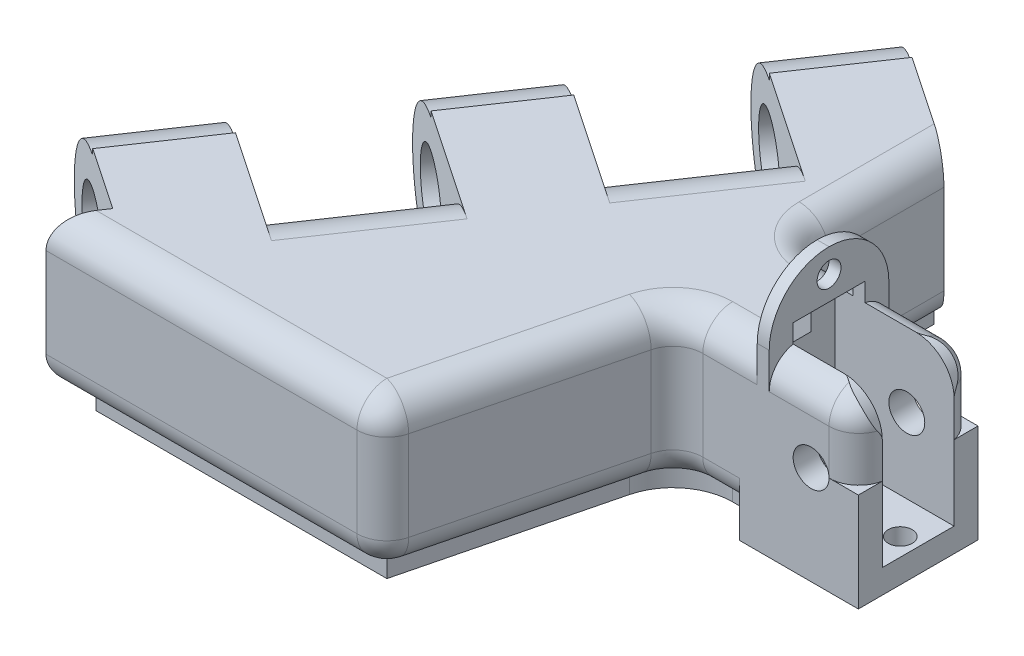
from build123d import *

# Parameters (mm, degrees)
SKETCH1_W            = 120
SKETCH1_H            = 120
SKETCH1_W_2          = 20
SKETCH1_H_2          = 20
SKETCH1_H_3          = 30
SKETCH1_W_3          = 30
BOSS_EXTRUDE1_DEPTH  = 25
CUT_EXTRUDE2_DEPTH   = 50
FILLET3_R            = 5
FILLET4_R            = 5
CUT_EXTRUDE4_DEPTH   = 130.711217711
SKETCH7_W            = 17.18
SKETCH7_H            = 25
BOSS_EXTRUDE2_DEPTH  = 25
FILLET5_R            = 10
CUT_EXTRUDE5_DEPTH   = 143.225012873
SKETCH9_R            = 6.665
CUT_EXTRUDE6_DEPTH   = 143.225012873
CUT_EXTRUDE7_DEPTH   = 143.225012873
SKETCH11_W           = 20
SKETCH11_H           = 25
CUT_EXTRUDE8_DEPTH   = 15
SKETCH12_W           = 40
SKETCH12_H           = 12
CUT_EXTRUDE9_DEPTH   = 112.018016556
SKETCH13_R           = 3
CUT_EXTRUDE10_DEPTH  = 112.914941802
BOSS_EXTRUDE3_REACH  = 113.915
SKETCH17_W           = 19.898979486
SKETCH17_H           = 12
CUT_EXTRUDE12_DEPTH  = 109.80292511
BOSS_EXTRUDE4_DEPTH  = 4
SKETCH19_W           = 4.898979486
SKETCH19_H           = 4
BOSS_EXTRUDE5_DEPTH  = 16.5
SKETCH20_W           = 15
SKETCH20_H           = 0.101020514
BOSS_EXTRUDE6_DEPTH  = 4
SKETCH21_W           = 15
SKETCH21_H           = 0.101020514
BOSS_EXTRUDE7_DEPTH  = 4
CUT_EXTRUDE13_DEPTH  = 112.914941802
SKETCH24_R           = 2
CUT_EXTRUDE14_DEPTH  = 112.905435687
SKETCH25_W           = 4
SKETCH25_H           = 4
BOSS_EXTRUDE8_DEPTH  = 2
CUT_EXTRUDE15_DEPTH  = 108.704680589
SKETCH27_W           = 4.472135955
SKETCH27_H           = 4
CUT_EXTRUDE16_DEPTH  = 104.54697643
SKETCH28_W           = 2
SKETCH28_H           = 4
BOSS_EXTRUDE9_DEPTH  = 40
SKETCH29_W           = 2
SKETCH29_H           = 8
BOSS_EXTRUDE10_DEPTH = 20
FILLET6_R            = 10
SKETCH30_R           = 2
CUT_EXTRUDE17_DEPTH  = 120.003275165
SCALE2_SCALE         = 0.75


# Some blends are built 0.0001 mm under size
with BuildPart() as part:
    # Sketch1 → Boss-Extrude1 (new body)
    with BuildSketch(Plane(origin=(0, 0, 0), x_dir=(1, 0, 0), z_dir=(0, 1, 0))):
        Rectangle(SKETCH1_W, SKETCH1_H)
        with Locations((50, 70)):
            Rectangle(SKETCH1_W_2, SKETCH1_H_2)
        with Locations((16.666666667, 75)):
            Rectangle(SKETCH1_W_2, SKETCH1_H_3)
        with Locations((-16.666666667, 75)):
            Rectangle(SKETCH1_W_2, SKETCH1_H_3)
        with Locations((-50, 70)):
            Rectangle(SKETCH1_W_2, SKETCH1_H_2)
        with Locations((75, -10)):
            Rectangle(SKETCH1_W_3, SKETCH1_H_2)
    extrude(amount=BOSS_EXTRUDE1_DEPTH)

    # Sketch3 → Cut-Extrude2 (cut)
    with BuildSketch(Plane(origin=(0, 25, 0), x_dir=(1, 0, 0), z_dir=(0, 1, 0))):
        Polygon((-60, 5), (-30, -60), (-60, -60), align=None)
        Polygon((50, -60), (60, -20), (60, -60), align=None)
    extrude(amount=-CUT_EXTRUDE2_DEPTH, mode=Mode.SUBTRACT)

    # Fillet3
    fillet3_edges = [part.edges().sort_by_distance(p)[0] for p in [
        (75, 25, 20),
        (75, 25, 0),
        (-40, 0, -70),
        (-33.333333333, 0, -60),
        (-26.666666667, 0, -75),
        (-6.666666667, 0, -75),
        (0, 0, -60),
        (60, 25, -40),
        (6.666666667, 0, -75),
        (26.666666667, 0, -75),
        (33.333333333, 0, -60),
        (40, 0, -70),
        (60, 0, -40),
        (75, 0, 0),
        (75, 0, 20),
        (40, 25, -70),
        (-60, 12.5, -80),
        (-40, 12.5, -80),
        (-40, 12.5, -60),
        (-26.666666667, 12.5, -60),
        (-26.666666667, 12.5, -90),
        (-6.666666667, 12.5, -90),
        (-6.666666667, 12.5, -60),
        (6.666666667, 12.5, -60),
        (6.666666667, 12.5, -90),
        (26.666666667, 12.5, -90),
        (26.666666667, 12.5, -60),
        (40, 12.5, -60),
        (40, 12.5, -80),
        (33.333333333, 25, -60),
        (60, 12.5, -80),
        (60, 12.5, 0),
        (60, 12.5, 20),
        (26.666666667, 25, -75),
        (6.666666667, 25, -75),
        (0, 25, -60),
        (-6.666666667, 25, -75),
        (10, 0, 60),
        (-60, 0, -42.5),
        (55, 0, 40),
        (-45, 0, 27.5),
        (-26.666666667, 25, -75),
        (10, 25, 60),
        (-60, 25, -42.5),
        (-33.333333333, 25, -60),
        (-60, 12.5, -5),
        (-30, 12.5, 60),
        (-45, 25, 27.5),
        (-40, 25, -70),
        (50, 12.5, 60),
        (55, 25, 40),
    ]]
    fillet(fillet3_edges, radius=FILLET3_R)

    # Fillet4
    # the kernel refuses this fillet: 5 mm, written as the material it takes off along each edge
    with BuildSketch(Plane(origin=(-45, 5, -75), x_dir=(0, 0, -1), z_dir=(0, -1, 0))) as fillet4_piece_1_section:
        Polygon((0, 0), (FILLET4_R, 0), (FILLET4_R, FILLET4_R), (0, FILLET4_R), align=None)
    fillet4_piece_1 = extrude(amount=FILLET4_R, mode=Mode.PRIVATE)
    fillet4_piece_1 = fillet4_piece_1 - Plane(origin=(-45, 5, -75), x_dir=(-0.7071067811865474, 0, 0.7071067811865477), z_dir=(0, -1, 0)) * Sphere(FILLET4_R, mode=Mode.PRIVATE)
    add(fillet4_piece_1, mode=Mode.SUBTRACT)
    with BuildSketch(Plane(origin=(-21.666666667, 5, -85), x_dir=(0, 0, -1), z_dir=(0, -1, 0))) as fillet4_piece_2_section:
        Polygon((0, 0), (FILLET4_R, 0), (FILLET4_R, -FILLET4_R), (0, -FILLET4_R), align=None)
    fillet4_piece_2 = extrude(amount=FILLET4_R, mode=Mode.PRIVATE)
    fillet4_piece_2 = fillet4_piece_2 - Plane(origin=(-21.666666667, 5, -85), x_dir=(0.7071067811865476, 0, 0.7071067811865475), z_dir=(0, -1, 0)) * Sphere(FILLET4_R, mode=Mode.PRIVATE)
    add(fillet4_piece_2, mode=Mode.SUBTRACT)
    with BuildSketch(Plane(origin=(-45, 20, -75), x_dir=(0, 0, -1), z_dir=(0, 1, 0))) as fillet4_piece_3_section:
        Polygon((0, 0), (FILLET4_R, 0), (FILLET4_R, -FILLET4_R), (0, -FILLET4_R), align=None)
    fillet4_piece_3 = extrude(amount=FILLET4_R, mode=Mode.PRIVATE)
    fillet4_piece_3 = fillet4_piece_3 - Plane(origin=(-45, 20, -75), x_dir=(-0.7071067811865474, 0, 0.7071067811865477), z_dir=(0, 1, 0)) * Sphere(FILLET4_R, mode=Mode.PRIVATE)
    add(fillet4_piece_3, mode=Mode.SUBTRACT)
    with BuildSketch(Plane(origin=(-21.666666667, 20, -85), x_dir=(0, 0, -1), z_dir=(0, 1, 0))) as fillet4_piece_4_section:
        Polygon((0, 0), (FILLET4_R, 0), (FILLET4_R, FILLET4_R), (0, FILLET4_R), align=None)
    fillet4_piece_4 = extrude(amount=FILLET4_R, mode=Mode.PRIVATE)
    fillet4_piece_4 = fillet4_piece_4 - Plane(origin=(-21.666666667, 20, -85), x_dir=(0.7071067811865476, 0, 0.7071067811865475), z_dir=(0, 1, 0)) * Sphere(FILLET4_R, mode=Mode.PRIVATE)
    add(fillet4_piece_4, mode=Mode.SUBTRACT)
    with BuildSketch(Plane(origin=(-11.666666667, 5, -85), x_dir=(0, 0, -1), z_dir=(0, -1, 0))) as fillet4_piece_5_section:
        Polygon((0, 0), (FILLET4_R, 0), (FILLET4_R, FILLET4_R), (0, FILLET4_R), align=None)
    fillet4_piece_5 = extrude(amount=FILLET4_R, mode=Mode.PRIVATE)
    fillet4_piece_5 = fillet4_piece_5 - Plane(origin=(-11.666666667, 5, -85), x_dir=(-0.7071067811865475, 0, 0.7071067811865475), z_dir=(0, -1, 0)) * Sphere(FILLET4_R, mode=Mode.PRIVATE)
    add(fillet4_piece_5, mode=Mode.SUBTRACT)
    with BuildSketch(Plane(origin=(11.666666667, 5, -85), x_dir=(0, 0, -1), z_dir=(0, -1, 0))) as fillet4_piece_6_section:
        Polygon((0, 0), (FILLET4_R, 0), (FILLET4_R, -FILLET4_R), (0, -FILLET4_R), align=None)
    fillet4_piece_6 = extrude(amount=FILLET4_R, mode=Mode.PRIVATE)
    fillet4_piece_6 = fillet4_piece_6 - Plane(origin=(11.666666667, 5, -85), x_dir=(0.7071067811865476, 0, 0.7071067811865475), z_dir=(0, -1, 0)) * Sphere(FILLET4_R, mode=Mode.PRIVATE)
    add(fillet4_piece_6, mode=Mode.SUBTRACT)
    with BuildSketch(Plane(origin=(-11.666666667, 20, -85), x_dir=(0, 0, -1), z_dir=(0, 1, 0))) as fillet4_piece_7_section:
        Polygon((0, 0), (FILLET4_R, 0), (FILLET4_R, -FILLET4_R), (0, -FILLET4_R), align=None)
    fillet4_piece_7 = extrude(amount=FILLET4_R, mode=Mode.PRIVATE)
    fillet4_piece_7 = fillet4_piece_7 - Plane(origin=(-11.666666667, 20, -85), x_dir=(-0.7071067811865475, 0, 0.7071067811865475), z_dir=(0, 1, 0)) * Sphere(FILLET4_R, mode=Mode.PRIVATE)
    add(fillet4_piece_7, mode=Mode.SUBTRACT)
    with BuildSketch(Plane(origin=(11.666666667, 20, -85), x_dir=(0, 0, -1), z_dir=(0, 1, 0))) as fillet4_piece_8_section:
        Polygon((0, 0), (FILLET4_R, 0), (FILLET4_R, FILLET4_R), (0, FILLET4_R), align=None)
    fillet4_piece_8 = extrude(amount=FILLET4_R, mode=Mode.PRIVATE)
    fillet4_piece_8 = fillet4_piece_8 - Plane(origin=(11.666666667, 20, -85), x_dir=(0.7071067811865476, 0, 0.7071067811865475), z_dir=(0, 1, 0)) * Sphere(FILLET4_R, mode=Mode.PRIVATE)
    add(fillet4_piece_8, mode=Mode.SUBTRACT)
    with BuildSketch(Plane(origin=(21.666666667, 5, -85), x_dir=(0, 0, -1), z_dir=(0, -1, 0))) as fillet4_piece_9_section:
        Polygon((0, 0), (FILLET4_R, 0), (FILLET4_R, FILLET4_R), (0, FILLET4_R), align=None)
    fillet4_piece_9 = extrude(amount=FILLET4_R, mode=Mode.PRIVATE)
    fillet4_piece_9 = fillet4_piece_9 - Plane(origin=(21.666666667, 5, -85), x_dir=(-0.7071067811865475, 0, 0.7071067811865477), z_dir=(0, -1, 0)) * Sphere(FILLET4_R, mode=Mode.PRIVATE)
    add(fillet4_piece_9, mode=Mode.SUBTRACT)
    with BuildSketch(Plane(origin=(45, 5, -75), x_dir=(0, 0, -1), z_dir=(0, -1, 0))) as fillet4_piece_10_section:
        Polygon((0, 0), (FILLET4_R, 0), (FILLET4_R, -FILLET4_R), (0, -FILLET4_R), align=None)
    fillet4_piece_10 = extrude(amount=FILLET4_R, mode=Mode.PRIVATE)
    fillet4_piece_10 = fillet4_piece_10 - Plane(origin=(45, 5, -75), x_dir=(0.7071067811865476, 0, 0.7071067811865474), z_dir=(0, -1, 0)) * Sphere(FILLET4_R, mode=Mode.PRIVATE)
    add(fillet4_piece_10, mode=Mode.SUBTRACT)
    with BuildSketch(Plane(origin=(21.666666667, 20, -85), x_dir=(0, 0, -1), z_dir=(0, 1, 0))) as fillet4_piece_11_section:
        Polygon((0, 0), (FILLET4_R, 0), (FILLET4_R, -FILLET4_R), (0, -FILLET4_R), align=None)
    fillet4_piece_11 = extrude(amount=FILLET4_R, mode=Mode.PRIVATE)
    fillet4_piece_11 = fillet4_piece_11 - Plane(origin=(21.666666667, 20, -85), x_dir=(-0.7071067811865475, 0, 0.7071067811865477), z_dir=(0, 1, 0)) * Sphere(FILLET4_R, mode=Mode.PRIVATE)
    add(fillet4_piece_11, mode=Mode.SUBTRACT)
    with BuildSketch(Plane(origin=(45, 20, -75), x_dir=(0, 0, -1), z_dir=(0, 1, 0))) as fillet4_piece_12_section:
        Polygon((0, 0), (FILLET4_R, 0), (FILLET4_R, FILLET4_R), (0, FILLET4_R), align=None)
    fillet4_piece_12 = extrude(amount=FILLET4_R, mode=Mode.PRIVATE)
    fillet4_piece_12 = fillet4_piece_12 - Plane(origin=(45, 20, -75), x_dir=(0.7071067811865476, 0, 0.7071067811865474), z_dir=(0, 1, 0)) * Sphere(FILLET4_R, mode=Mode.PRIVATE)
    add(fillet4_piece_12, mode=Mode.SUBTRACT)
    with BuildSketch(Plane(origin=(55, 5, -75), x_dir=(0, 0, -1), z_dir=(0, -1, 0))) as fillet4_piece_13_section:
        Polygon((0, 0), (FILLET4_R, 0), (FILLET4_R, FILLET4_R), (0, FILLET4_R), align=None)
    fillet4_piece_13 = extrude(amount=FILLET4_R, mode=Mode.PRIVATE)
    fillet4_piece_13 = fillet4_piece_13 - Plane(origin=(55, 5, -75), x_dir=(-0.7071067811865475, 0, 0.7071067811865475), z_dir=(0, -1, 0)) * Sphere(FILLET4_R, mode=Mode.PRIVATE)
    add(fillet4_piece_13, mode=Mode.SUBTRACT)
    with BuildSketch(Plane(origin=(55, 20, -75), x_dir=(0, 0, -1), z_dir=(0, 1, 0))) as fillet4_piece_14_section:
        Polygon((0, 0), (FILLET4_R, 0), (FILLET4_R, -FILLET4_R), (0, -FILLET4_R), align=None)
    fillet4_piece_14 = extrude(amount=FILLET4_R, mode=Mode.PRIVATE)
    fillet4_piece_14 = fillet4_piece_14 - Plane(origin=(55, 20, -75), x_dir=(-0.7071067811865475, 0, 0.7071067811865475), z_dir=(0, 1, 0)) * Sphere(FILLET4_R, mode=Mode.PRIVATE)
    add(fillet4_piece_14, mode=Mode.SUBTRACT)
    with BuildSketch(Plane(origin=(-55, 20, -75), x_dir=(0, 0, -1), z_dir=(0, 1, 0))) as fillet4_piece_15_section:
        Polygon((0, 0), (FILLET4_R, 0), (FILLET4_R, FILLET4_R), (0, FILLET4_R), align=None)
    fillet4_piece_15 = extrude(amount=FILLET4_R, mode=Mode.PRIVATE)
    fillet4_piece_15 = fillet4_piece_15 - Plane(origin=(-55, 20, -75), x_dir=(0.7071067811865475, 0, 0.7071067811865475), z_dir=(0, 1, 0)) * Sphere(FILLET4_R, mode=Mode.PRIVATE)
    add(fillet4_piece_15, mode=Mode.SUBTRACT)
    with BuildSketch(Plane(origin=(-55, 5, -75), x_dir=(0, 0, -1), z_dir=(0, -1, 0))) as fillet4_piece_16_section:
        Polygon((0, 0), (FILLET4_R, 0), (FILLET4_R, -FILLET4_R), (0, -FILLET4_R), align=None)
    fillet4_piece_16 = extrude(amount=FILLET4_R, mode=Mode.PRIVATE)
    fillet4_piece_16 = fillet4_piece_16 - Plane(origin=(-55, 5, -75), x_dir=(0.7071067811865475, 0, 0.7071067811865475), z_dir=(0, -1, 0)) * Sphere(FILLET4_R, mode=Mode.PRIVATE)
    add(fillet4_piece_16, mode=Mode.SUBTRACT)
    with BuildSketch(Plane(origin=(90, 25, 15), x_dir=(-1, 0, 0), z_dir=(0, 0, -1)), Plane(origin=(55, 25, -80), x_dir=(0, 0, 1), z_dir=(-1, 0, 0)), Plane(origin=(21.666666667, 25, -90), x_dir=(0, 0, 1), z_dir=(-1, 0, 0)), Plane(origin=(-11.666666667, 25, -90), x_dir=(0, 0, 1), z_dir=(-1, 0, 0)), Plane(origin=(-45, 25, -80), x_dir=(0, 0, 1), z_dir=(-1, 0, 0))) as fillet4_piece_17:
        with BuildLine():
            CenterArc((FILLET4_R, -FILLET4_R), FILLET4_R, 90, 90)
            Line((0, -FILLET4_R), (0, 0))
            Line((0, 0), (FILLET4_R, 0))
        make_face()
    extrude(amount=10, mode=Mode.SUBTRACT)
    with BuildSketch(Plane(origin=(-45, 0, -80), x_dir=(0, 0, 1), z_dir=(-1, 0, 0)), Plane(origin=(-11.666666667, 0, -90), x_dir=(0, 0, 1), z_dir=(-1, 0, 0)), Plane(origin=(21.666666667, 0, -90), x_dir=(0, 0, 1), z_dir=(-1, 0, 0)), Plane(origin=(55, 0, -80), x_dir=(0, 0, 1), z_dir=(-1, 0, 0)), Plane(origin=(90, 0, 15), x_dir=(-1, 0, 0), z_dir=(0, 0, -1))) as fillet4_piece_18:
        with BuildLine():
            CenterArc((FILLET4_R, FILLET4_R), FILLET4_R, 180, 90)
            Line((0, FILLET4_R), (0, 0))
            Line((0, 0), (FILLET4_R, 0))
        make_face()
    extrude(amount=10, mode=Mode.SUBTRACT)
    with BuildSketch(Plane(origin=(90, 5, 0), x_dir=(0, 0, 1), z_dir=(0, 1, 0))) as fillet4_piece_19:
        with BuildLine():
            CenterArc((FILLET4_R, -FILLET4_R), FILLET4_R, 90, 90)
            Line((0, -FILLET4_R), (0, 0))
            Line((0, 0), (FILLET4_R, 0))
        make_face()
    extrude(amount=15, mode=Mode.SUBTRACT)
    with BuildSketch(Plane(origin=(90, 5, 20), x_dir=(0, 0, -1), z_dir=(0, 1, 0))) as fillet4_piece_20:
        with BuildLine():
            CenterArc((FILLET4_R, FILLET4_R), FILLET4_R, 180, 90)
            Line((0, FILLET4_R), (0, 0))
            Line((0, 0), (FILLET4_R, 0))
        make_face()
    extrude(amount=15, mode=Mode.SUBTRACT)
    with BuildSketch(Plane(origin=(90, 20, 15), x_dir=(0, 1, 0), z_dir=(0, 0, -1))) as fillet4_piece_21:
        with BuildLine():
            CenterArc((5 - FILLET4_R, -FILLET4_R), FILLET4_R, 0, 90)
            Line((5, -FILLET4_R), (5, 0))
            Line((5, 0), (5 - FILLET4_R, 0))
        make_face()
    revolve(axis=Axis((90, 20, 15), (1, 0, 0)), revolution_arc=90, mode=Mode.SUBTRACT)
    with BuildSketch(Plane(origin=(90, 5, 15), x_dir=(0, -1, 0), z_dir=(0, 0, -1))) as fillet4_piece_22:
        with BuildLine():
            CenterArc((5 - FILLET4_R, FILLET4_R), FILLET4_R, 270, 90)
            Line((5 - FILLET4_R, 0), (5, 0))
            Line((5, 0), (5, FILLET4_R))
        make_face()
    revolve(axis=Axis((90, 5, 15), (-1, 0, 0)), revolution_arc=90, mode=Mode.SUBTRACT)
    with BuildSketch(Plane(origin=(90, 5, 5), x_dir=(0, -1, 0), z_dir=(0, 0, 1))) as fillet4_piece_23:
        with BuildLine():
            CenterArc((5 - FILLET4_R, -FILLET4_R), FILLET4_R, 0, 90)
            Line((5, -FILLET4_R), (5, 0))
            Line((5, 0), (5 - FILLET4_R, 0))
        make_face()
    revolve(axis=Axis((90, 5, 5), (1, 0, 0)), revolution_arc=90, mode=Mode.SUBTRACT)
    with BuildSketch(Plane(origin=(90, 20, 5), x_dir=(0, 1, 0), z_dir=(0, 0, 1))) as fillet4_piece_24:
        with BuildLine():
            CenterArc((5 - FILLET4_R, FILLET4_R), FILLET4_R, 270, 90)
            Line((5, FILLET4_R), (5, 0))
            Line((5, 0), (5 - FILLET4_R, 0))
        make_face()
    revolve(axis=Axis((90, 20, 5), (-1, 0, 0)), revolution_arc=90, mode=Mode.SUBTRACT)

    # Sketch6 → Cut-Extrude4 (cut, through all)
    with BuildSketch(Plane(origin=(0, 25, 0), x_dir=(1, 0, 0), z_dir=(0, 1, 0))):
        Polygon((126.972014279, 136.391861769), (-26.800838053, -90.921215585), (-300.536864173, -90.921215585), (-300.536864173, 228.05703848), (126.972014279, 228.05703848), align=None)
    extrude(amount=-CUT_EXTRUDE4_DEPTH, mode=Mode.SUBTRACT)

    # Sketch7 → Boss-Extrude2 (add)
    with BuildSketch(Plane(origin=(23.809668203, 0, 16.106775005), x_dir=(-0.56031497026087, 0, 0.8282796231355452), z_dir=(-0.8282796231355452, 0, -0.56031497026087))):
        with Locations((36.366636272, 12.5)):
            Rectangle(SKETCH7_W, SKETCH7_H)
        with Locations((-4.354537893, 12.5)):
            Rectangle(SKETCH7_W, SKETCH7_H)
        with Locations((-45.075712058, 12.5)):
            Rectangle(SKETCH7_W, SKETCH7_H)
    extrude(amount=BOSS_EXTRUDE2_DEPTH)

    # Fillet5
    fillet5_edges = [part.edges().sort_by_distance(p)[0] for p in [
        (14.841239228, 0, 29.364259395),
        (14.841239228, 25, 29.364259395),
        (37.657922719, 0, -4.364259395),
        (37.657922719, 25, -4.364259395),
    ]]
    fillet(fillet5_edges, radius=FILLET5_R)

    # Sketch8 → Cut-Extrude5 (cut, through all)
    with BuildSketch(Plane(origin=(-25.189876316, 0, 37.236665748), x_dir=(0.828279623135545, 0, 0.5603149702608698), z_dir=(-0.5603149702608698, 0, 0.828279623135545))):
        with BuildLine():
            Line((3.745930165, 0), (16.245930165, 0))
            ThreePointArc((16.245930165, 0), (7.4070954, 3.661165235), (3.745930165, 12.5))
            Line((3.745930165, 12.5), (3.745930165, 0))
        make_face()
        with BuildLine():
            Line((3.745930165, 25), (3.745930165, 12.5))
            ThreePointArc((3.745930165, 12.5), (7.4070954, 21.338834765), (16.245930165, 25))
            Line((16.245930165, 25), (3.745930165, 25))
        make_face()
    extrude(amount=-CUT_EXTRUDE5_DEPTH, mode=Mode.SUBTRACT)

    # Sketch9 → Cut-Extrude6 (cut, through all)
    with BuildSketch(Plane(origin=(-25.189876316, 0, 37.236665748), x_dir=(0.828279623135545, 0, 0.5603149702608698), z_dir=(-0.5603149702608698, 0, 0.828279623135545))):
        with Locations((16.245930165, 12.5)):
            Circle(SKETCH9_R)
    extrude(amount=-CUT_EXTRUDE6_DEPTH, mode=Mode.SUBTRACT)

    # Sketch10 → Cut-Extrude7 (cut, through all)
    with BuildSketch(Plane(origin=(-25.189876316, 0, 37.236665748), x_dir=(0.828279623135545, 0, 0.5603149702608698), z_dir=(-0.5603149702608698, 0, 0.828279623135545))):
        with BuildLine():
            Line((16.245930165, 25), (16.245930165, 24))
            ThreePointArc((16.245930165, 24), (4.745930165, 12.5), (16.245930165, 1))
            Line((16.245930165, 1), (16.245930165, 0))
            Line((16.245930165, 0), (-13.754069835, 0))
            Line((-13.754069835, 0), (-13.754069835, 25))
            Line((-13.754069835, 25), (16.245930165, 25))
        make_face()
    extrude(amount=-CUT_EXTRUDE7_DEPTH, mode=Mode.SUBTRACT)

    # Sketch11 → Cut-Extrude8 (cut)
    with BuildSketch(Plane(origin=(23.809668203, 0, 16.106775005), x_dir=(-0.56031497026087, 0, 0.8282796231355452), z_dir=(-0.8282796231355452, 0, -0.56031497026087))):
        with Locations((-63.665712058, 12.5)):
            Rectangle(SKETCH11_W, SKETCH11_H)
    extrude(amount=-CUT_EXTRUDE8_DEPTH, mode=Mode.SUBTRACT)

    # Sketch12 → Cut-Extrude9 (cut, through all)
    with BuildSketch(Plane(origin=(0, 25, 0), x_dir=(1, 0, 0), z_dir=(0, 1, 0))):
        with Locations((90, -10)):
            Rectangle(SKETCH12_W, SKETCH12_H)
    extrude(amount=-CUT_EXTRUDE9_DEPTH, mode=Mode.SUBTRACT)

    # Sketch13 → Cut-Extrude10 (cut, through all)
    with BuildSketch(Plane.XY.offset(20)):
        with Locations((82, 12.5)):
            Circle(SKETCH13_R)
    extrude(amount=-CUT_EXTRUDE10_DEPTH, mode=Mode.SUBTRACT)

    # Boss-Extrude3: up to this face of the body (flat: up to its plane)
    boss_extrude3_end = Plane(part.part.faces().sort_by_distance((74.271617069, 12.5, 0))[0])
    # Sketch16 → Boss-Extrude3 (add, up to the picked face)
    with BuildSketch(Plane.XY.offset(20), mode=Mode.PRIVATE) as boss_extrude3_sk1:
        with BuildLine():
            Line((85, 12.5), (89.898979486, 12.5))
            Line((89.898979486, 12.5), (89.898979486, 5))
            ThreePointArc((89.898979486, 5), (88.464101615, 1.535898385), (85, 0.101020514))
            Line((85, 0.101020514), (70, 0.101020514))
            Line((70, 0.101020514), (70, 12.5))
            Line((70, 12.5), (79, 12.5))
            ThreePointArc((79, 12.5), (82, 9.5), (85, 12.5))
        make_face()
    boss_extrude3_tool1 = split(extrude(boss_extrude3_sk1.sketch, amount=-BOSS_EXTRUDE3_REACH, mode=Mode.PRIVATE), bisect_by=boss_extrude3_end, keep=Keep.BOTH, mode=Mode.PRIVATE)
    add(boss_extrude3_tool1.solids().sort_by(Axis((79.621505, 6.109914, 20), (0, 0, -1)))[0])

    # Sketch17 → Cut-Extrude12 (cut, through all)
    with BuildSketch(Plane(origin=(0, 12.5, 0), x_dir=(1, 0, 0), z_dir=(0, 1, 0))):
        with Locations((79.949489743, -10)):
            Rectangle(SKETCH17_W, SKETCH17_H)
    extrude(amount=-CUT_EXTRUDE12_DEPTH, mode=Mode.SUBTRACT)

    # Sketch18 → Boss-Extrude4 (add)
    with BuildSketch(Plane(origin=(0, 0, 0), x_dir=(-1, 0, 0), z_dir=(0, -1, 0))):
        with BuildLine():
            Line((-89.898979486, 0), (-89.898979486, -20))
            Line((-89.898979486, -20), (-70, -20))
            Line((-70, -20), (-70, -15))
            Line((-70, -15), (-63.903882032, -15))
            ThreePointArc((-63.903882032, -15), (-57.749759938, -17.11794562), (-54.202457031, -22.57464375))
            Line((-54.202457031, -22.57464375), (-46.096117968, -55))
            Line((-46.096117968, -55), (2.500838053, -55))
            Line((2.500838053, -55), (1.380208112, -53.343440754))
            Line((1.380208112, -53.343440754), (11.733703401, -46.339503625))
            Line((11.733703401, -46.339503625), (2.107492212, -32.1096597))
            Line((2.107492212, -32.1096597), (-16.528799308, -44.716746531))
            Line((-16.528799308, -44.716746531), (-29.719271611, -25.218071665))
            Line((-29.719271611, -25.218071665), (-11.08298009, -12.610984834))
            Line((-11.08298009, -12.610984834), (-20.709191279, 1.618859091))
            Line((-20.709191279, 1.618859091), (-39.3454828, -10.98822774))
            Line((-39.3454828, -10.98822774), (-52.535955102, 8.510447126))
            Line((-52.535955102, 8.510447126), (-33.899663581, 21.117533957))
            Line((-33.899663581, 21.117533957), (-43.52587477, 35.347377882))
            Line((-43.52587477, 35.347377882), (-55, 27.58535651))
            Line((-55, 27.58535651), (-55, 5))
            ThreePointArc((-55, 5), (-57.928932188, -2.071067812), (-65, -5))
            Line((-65, -5), (-70, -5))
            Line((-70, -5), (-70, 0))
            Line((-70, 0), (-89.898979486, 0))
        make_face()
    extrude(amount=BOSS_EXTRUDE4_DEPTH)

    # Sketch19 → Boss-Extrude5 (add)
    with BuildSketch(Plane(origin=(0, 12.5, 0), x_dir=(1, 0, 0), z_dir=(0, 1, 0))):
        with Locations((87.449489743, -2)):
            Rectangle(SKETCH19_W, SKETCH19_H)
        with Locations((87.449489743, -18)):
            Rectangle(SKETCH19_W, SKETCH19_H)
    extrude(amount=-BOSS_EXTRUDE5_DEPTH)

    # Sketch20 → Boss-Extrude6 (add)
    with BuildSketch(Plane.XY.offset(20)):
        with Locations((77.5, 0.050510257)):
            Rectangle(SKETCH20_W, SKETCH20_H)
    extrude(amount=-BOSS_EXTRUDE6_DEPTH)

    # Sketch21 → Boss-Extrude7 (add)
    with BuildSketch(Plane(origin=(0, 0, 0), x_dir=(-1, 0, 0), z_dir=(0, 0, -1))):
        with Locations((-77.5, 0.050510257)):
            Rectangle(SKETCH21_W, SKETCH21_H)
    extrude(amount=-BOSS_EXTRUDE7_DEPTH)

    # Sketch23 → Cut-Extrude13 (cut, through all)
    with BuildSketch(Plane.XY.offset(20)):
        with BuildLine():
            Line((83.5, 24.898979486), (89.898979486, 24.898979486))
            Line((89.898979486, 24.898979486), (89.898979486, 18.5))
            ThreePointArc((89.898979486, 18.5), (88.024761787, 23.024761787), (83.5, 24.898979486))
        make_face()
    extrude(amount=-CUT_EXTRUDE13_DEPTH, mode=Mode.SUBTRACT)

    # Sketch24 → Cut-Extrude14 (cut, through all)
    with BuildSketch(Plane(origin=(0, -4, 0), x_dir=(-1, 0, 0), z_dir=(0, -1, 0))):
        with Locations(Location((-86.898979486, -10, 0), (0, 0, 90))):
            Circle(SKETCH24_R)
    extrude(amount=-CUT_EXTRUDE14_DEPTH, mode=Mode.SUBTRACT)

    # Sketch25 → Boss-Extrude8 (add)
    with BuildSketch(Plane(origin=(0, -4, 0), x_dir=(-1, 0, 0), z_dir=(0, -1, 0))):
        with Locations((-54.898979486, -10)):
            Rectangle(SKETCH25_W, SKETCH25_H)
    extrude(amount=BOSS_EXTRUDE8_DEPTH)

    # Sketch26 → Cut-Extrude15 (cut, through all)
    with BuildSketch(Plane.XY.offset(12)):
        Polygon((52.898979486, -4), (56.898979486, -6), (52.898979486, -6), align=None)
    extrude(amount=-CUT_EXTRUDE15_DEPTH, mode=Mode.SUBTRACT)

    # Sketch27 → Cut-Extrude16 (cut, through all)
    with BuildSketch(Plane(origin=(8.979795897, 17.959591794, 0), x_dir=(-0.894427190999916, 0.44721359549995765, 0), z_dir=(-0.4472135954999577, -0.8944271909999161, 0))):
        with Locations((-51.339207988, -10)):
            Rectangle(SKETCH27_W, SKETCH27_H)
    extrude(amount=-CUT_EXTRUDE16_DEPTH, mode=Mode.SUBTRACT)

    # Sketch28 → Boss-Extrude9 (add)
    with BuildSketch(Plane(origin=(0, -4, 0), x_dir=(-1, 0, 0), z_dir=(0, -1, 0))):
        with Locations((-74, -2)):
            Rectangle(SKETCH28_W, SKETCH28_H)
        with Locations((-74, -18)):
            Rectangle(SKETCH28_W, SKETCH28_H)
    extrude(amount=-BOSS_EXTRUDE9_DEPTH)

    # Sketch29 → Boss-Extrude10 (add)
    with BuildSketch(Plane.XY.offset(20)):
        with Locations((74, 32)):
            Rectangle(SKETCH29_W, SKETCH29_H)
    extrude(amount=-BOSS_EXTRUDE10_DEPTH)

    # Fillet6
    fillet6_edges = [part.edges().sort_by_distance(p)[0] for p in [
        (74, 36, 20),
        (74, 36, 0),
    ]]
    fillet(fillet6_edges, radius=FILLET6_R - 0.0001)  # a hair under: the kernel refuses the full size

    # Sketch30 → Cut-Extrude17 (cut, through all)
    with BuildSketch(Plane(origin=(75, 0, 0), x_dir=(0, 0, -1), z_dir=(1, 0, 0))):
        with Locations((-10, 32)):
            Circle(SKETCH30_R)
    extrude(amount=-CUT_EXTRUDE17_DEPTH, mode=Mode.SUBTRACT)


with BuildPart() as part_1:
    # Scale2: scaled about (36.250109288, 10.940178615, 21.608791036)
    add(part.part.scale(SCALE2_SCALE).moved(Location((9.062527322, 2.735044654, 5.402197759))))


solid = part_1.part
